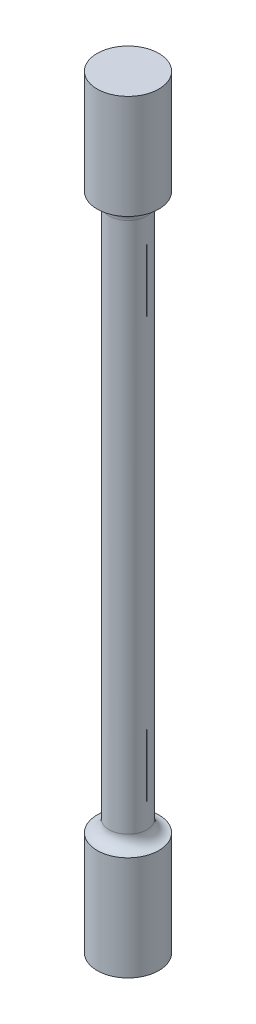
from build123d import *

# Parameters (mm, degrees)
SKETCH1_R               = 21.39
BOSS_EXTRUDE1_DEPTH     = 630
SKETCH2_R               = 35
BOSS_EXTRUDE2_DEPTH     = 88.02
BOSS_EXTRUDE3_START     = 88.02
SKETCH3_R               = 35
BOSS_EXTRUDE3_DEPTH     = 88.02
FILLET3_R               = 13.575
MOVE_FACE1_BY           = 30
MOVE_FACE2_BY           = 30
CUT_EXTRUDE1_DEPTH      = 750.655867982
CUT_EXTRUDE1_DEPTH_BACK = 750.655867982
CUT_EXTRUDE2_START      = -21.390000045
CUT_EXTRUDE2_DEPTH      = 21.390000045


# Read off the part's stored shape, not the designer's step: Cut-Extrude2
with BuildPart() as part:
    # Sketch1 → Boss-Extrude1 (new body)
    with BuildSketch(Plane(origin=(0, 0, 0), x_dir=(1, 0, 0), z_dir=(0, 1, 0))):
        with Locations(Location((0, 0, 0), (0, 0, 270))):
            Circle(SKETCH1_R)
    extrude(amount=BOSS_EXTRUDE1_DEPTH)

    # Sketch2 → Boss-Extrude2 (add)
    with BuildSketch(Plane(origin=(0, 630, 0), x_dir=(1, 0, 0), z_dir=(0, 1, 0))):
        with Locations(Location((0, 0, 0), (0, 0, 270))):
            Circle(SKETCH2_R)
    extrude(amount=BOSS_EXTRUDE2_DEPTH)

    # Sketch3 → Boss-Extrude3 (add)
    with BuildSketch(Plane.XZ.offset(BOSS_EXTRUDE3_START)):
        with Locations(Location((0, 0, 0), (0, 0, 90))):
            Circle(SKETCH3_R)
    extrude(amount=-BOSS_EXTRUDE3_DEPTH)

    # Fillet3
    fillet3_edges = [part.edges().sort_by_distance(p)[0] for p in [
        (0, 630, -21.39),
        (0, 0, -21.39),
    ]]
    fillet(fillet3_edges, radius=FILLET3_R)

    # Move Face1: a face moved outward by 30.0
    extrude(part.faces().sort_by_distance((0, 718.02, 0))[0], amount=MOVE_FACE1_BY, dir=(0, 1, 0))

    # Move Face2: a face moved outward by 30.0
    extrude(part.faces().sort_by_distance((0, -88.02, 0))[0], amount=MOVE_FACE2_BY, dir=(0, -1, 0))

    # Sketch4 → Cut-Extrude1 (cut, two sides: drawn at the far end of the back side and taken through both)
    with BuildSketch(Plane(origin=(0, 0, 0), x_dir=(0, 0, -1), z_dir=(1, 0, 0)).offset(-CUT_EXTRUDE1_DEPTH_BACK)):
        with BuildLine():
            Line((-0.43, 588.175), (-0.43, 518.175))
            ThreePointArc((-0.43, 518.175), (0, 517.745), (0.43, 518.175))
            Line((0.43, 518.175), (0.43, 588.175))
            ThreePointArc((0.43, 588.175), (0, 588.605), (-0.43, 588.175))
        make_face()
        with BuildLine():
            Line((-0.43, 111.71612329), (-0.43, 41.71612329))
            ThreePointArc((-0.43, 41.71612329), (0, 41.28612329), (0.43, 41.71612329))
            Line((0.43, 41.71612329), (0.43, 111.71612329))
            ThreePointArc((0.43, 111.71612329), (0, 112.14612329), (-0.43, 111.71612329))
        make_face()
    extrude(amount=CUT_EXTRUDE1_DEPTH + CUT_EXTRUDE1_DEPTH_BACK, mode=Mode.SUBTRACT)

    # Cut-Extrude2 outline → Cut-Extrude2 (cut)
    with BuildSketch(Plane(origin=(0, 0, 0), x_dir=(0, 0, -1), z_dir=(1, 0, 0)).offset(CUT_EXTRUDE2_START)):
        with BuildLine():
            ThreePointArc((-0.43, 260.7089), (0, 260.2789), (0.43, 260.7089))
            Line((0.43, 260.7089), (0.43, 320.7089))
            ThreePointArc((0.43, 320.7089), (0, 321.1389), (-0.43, 320.7089))
            Line((-0.43, 320.7089), (-0.43, 260.7089))
        make_face()
    extrude(amount=CUT_EXTRUDE2_DEPTH, mode=Mode.SUBTRACT)


solid = part.part
